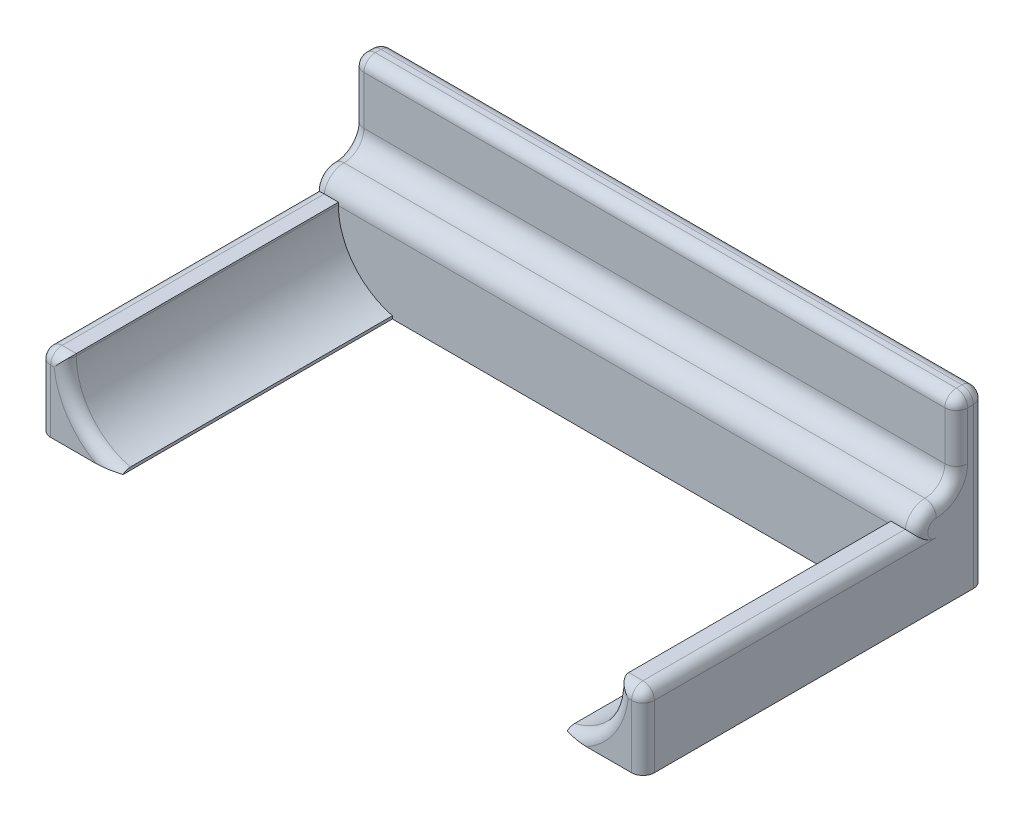
from build123d import *

# Parameters (mm, degrees)
ESQUISSE1_W             = 53
ESQUISSE1_H             = 20
BOSS_EXTRU_1_DEPTH      = 30
ESQUISSE2_W             = 53
ESQUISSE2_H             = 27.5
ENL_V_MAT_EXTRU_1_DEPTH = 17.5
ESQUISSE8_W             = 53
ESQUISSE8_H             = 5
ENL_V_MAT_EXTRU_5_DEPTH = 65.101482042
ESQUISSE10_W            = 39
ESQUISSE10_H            = 24
ENL_V_MAT_EXTRU_6_DEPTH = 3
ESQUISSE11_W            = 53
ESQUISSE11_H            = 3.5
BOSS_EXTRU_3_DEPTH      = 5.5
ESQUISSE12_W            = 4.75
ESQUISSE12_H            = 24
ENL_V_MAT_EXTRU_7_DEPTH = 2.25
ESQUISSE13_W            = 2.25
ESQUISSE13_H            = 24
BOSS_EXTRU_4_DEPTH      = 4
CONG_14_R               = 1.75
CONG_16_R               = 6.25
CONG_17_R               = 1


# Some blends are built 0.0001 mm under size
with BuildPart() as part:
    # Esquisse1 → Boss.-Extru.1 (new body)
    with BuildSketch(Plane.XY):
        with Locations((26.5, 10)):
            Rectangle(ESQUISSE1_W, ESQUISSE1_H)
    extrude(amount=BOSS_EXTRU_1_DEPTH)

    # Esquisse2 → Enlèv. mat.-Extru.1 (cut)
    with BuildSketch(Plane(origin=(0, 20, 0), x_dir=(1, 0, 0), z_dir=(0, 1, 0))):
        with Locations((26.5, -16.25)):
            Rectangle(ESQUISSE2_W, ESQUISSE2_H)
    extrude(amount=-ENL_V_MAT_EXTRU_1_DEPTH, mode=Mode.SUBTRACT)

    # Esquisse8 → Enlèv. mat.-Extru.5 (cut, through all)
    with BuildSketch(Plane(origin=(0, 0, 0), x_dir=(-1, 0, 0), z_dir=(0, 0, -1))):
        with Locations((-26.5, 17.5)):
            Rectangle(ESQUISSE8_W, ESQUISSE8_H)
    extrude(amount=-ENL_V_MAT_EXTRU_5_DEPTH, mode=Mode.SUBTRACT)

    # Esquisse10 → Enlèv. mat.-Extru.6 (cut)
    with BuildSketch(Plane(origin=(0, 2.5, 0), x_dir=(1, 0, 0), z_dir=(0, 1, 0))):
        with Locations((26.5, -18)):
            Rectangle(ESQUISSE10_W, ESQUISSE10_H)
    extrude(amount=-ENL_V_MAT_EXTRU_6_DEPTH, mode=Mode.SUBTRACT)

    # Esquisse11 → Boss.-Extru.3 (add)
    with BuildSketch(Plane(origin=(0, 2.5, 0), x_dir=(1, 0, 0), z_dir=(0, 1, 0))):
        with Locations((26.5, -4.25)):
            Rectangle(ESQUISSE11_W, ESQUISSE11_H)
    extrude(amount=BOSS_EXTRU_3_DEPTH)

    # Esquisse12 → Enlèv. mat.-Extru.7 (cut)
    with BuildSketch(Plane(origin=(0, 2.5, 0), x_dir=(1, 0, 0), z_dir=(0, 1, 0))):
        with Locations((4.625, -18)):
            Rectangle(ESQUISSE12_W, ESQUISSE12_H)
        with Locations((48.375, -18)):
            Rectangle(ESQUISSE12_W, ESQUISSE12_H)
    extrude(amount=-ENL_V_MAT_EXTRU_7_DEPTH, mode=Mode.SUBTRACT)

    # Esquisse13 → Boss.-Extru.4 (add)
    with BuildSketch(Plane(origin=(0, 2.5, 0), x_dir=(1, 0, 0), z_dir=(0, 1, 0))):
        with Locations((1.125, -18)):
            Rectangle(ESQUISSE13_W, ESQUISSE13_H)
        with Locations((51.875, -18)):
            Rectangle(ESQUISSE13_W, ESQUISSE13_H)
    extrude(amount=BOSS_EXTRU_4_DEPTH)

    # Congé14
    cong_14_edges = [part.edges().sort_by_distance(p)[0] for p in [
        (26.5, 8, 6),
        (26.5, 8, 2.5),
    ]]
    fillet(cong_14_edges, radius=CONG_14_R - 0.0001)  # a hair under: the kernel refuses the full size

    # Congé16
    # the kernel refuses this fillet: 6.25 mm, written as the material it adds along each edge
    with BuildSketch(Plane(origin=(2.25, 0.25, 30), x_dir=(0, 1, 0), z_dir=(0, 0, -1)), Plane(origin=(50.75, 0.25, 6), x_dir=(0, 1, 0), z_dir=(0, 0, 1))) as cong_16_piece_1:
        with BuildLine():
            CenterArc((6.06733055, 6.25), CONG_16_R, 193.886540363, 76.113459637)
            Line((0, 4.75), (-0.121346611, 4.72))
            ThreePointArc((-0.121346611, 4.72), (-0.125, 2.375), (-0.125, 0))
            Line((-0.125, 0), (0, -0.125))
            Line((0, -0.125), (6.06733055, -0.125))
            Line((6.06733055, -0.125), (6.06733055, 0))
        make_face()
    extrude(amount=24)

    # Congé17
    # the kernel refuses this fillet: 1 mm, written as the material it takes off along each edge
    with BuildSketch(Plane(origin=(52, 14, 1.5), x_dir=(1, 0, 0), z_dir=(0, 1, 0))) as cong_17_piece_1_section:
        Polygon((0, 0), (CONG_17_R, 0), (CONG_17_R, -CONG_17_R), (0, -CONG_17_R), align=None)
    cong_17_piece_1 = extrude(amount=CONG_17_R, mode=Mode.PRIVATE)
    cong_17_piece_1 = cong_17_piece_1 - Plane(origin=(52, 14, 1.5), x_dir=(-0.7071067811865475, 0, -0.7071067811865475), z_dir=(0, 1, 0)) * Sphere(CONG_17_R, mode=Mode.PRIVATE)
    add(cong_17_piece_1, mode=Mode.SUBTRACT)
    with BuildSketch(Plane(origin=(1, 14, 1.5), x_dir=(0, 0, 1), z_dir=(0, 1, 0))) as cong_17_piece_2_section:
        Polygon((0, 0), (CONG_17_R, 0), (CONG_17_R, -CONG_17_R), (0, -CONG_17_R), align=None)
    cong_17_piece_2 = extrude(amount=CONG_17_R, mode=Mode.PRIVATE)
    cong_17_piece_2 = cong_17_piece_2 - Plane(origin=(1, 14, 1.5), x_dir=(0.7071067811865475, 0, -0.7071067811865475), z_dir=(0, 1, 0)) * Sphere(CONG_17_R, mode=Mode.PRIVATE)
    add(cong_17_piece_2, mode=Mode.SUBTRACT)
    with BuildSketch(Plane(origin=(52, 14, 1), x_dir=(0, 1, 0), z_dir=(0, 0, -1))) as cong_17_piece_3_section:
        Polygon((0, 0), (CONG_17_R, 0), (CONG_17_R, CONG_17_R), (0, CONG_17_R), align=None)
    cong_17_piece_3 = extrude(amount=CONG_17_R, mode=Mode.PRIVATE)
    cong_17_piece_3 = cong_17_piece_3 - Plane(origin=(52, 14, 1), x_dir=(-0.7071067811865475, -0.7071067811865475, 0), z_dir=(0, 0, -1)) * Sphere(CONG_17_R, mode=Mode.PRIVATE)
    add(cong_17_piece_3, mode=Mode.SUBTRACT)
    with BuildSketch(Plane(origin=(1, 14, 1), x_dir=(0, 1, 0), z_dir=(0, 0, -1))) as cong_17_piece_4_section:
        Polygon((0, 0), (CONG_17_R, 0), (CONG_17_R, -CONG_17_R), (0, -CONG_17_R), align=None)
    cong_17_piece_4 = extrude(amount=CONG_17_R, mode=Mode.PRIVATE)
    cong_17_piece_4 = cong_17_piece_4 - Plane(origin=(1, 14, 1), x_dir=(0.7071067811865475, -0.7071067811865475, 0), z_dir=(0, 0, -1)) * Sphere(CONG_17_R, mode=Mode.PRIVATE)
    add(cong_17_piece_4, mode=Mode.SUBTRACT)
    with BuildSketch(Plane(origin=(1, 5.5, 29), x_dir=(-1, 0, 0), z_dir=(0, 0, 1))) as cong_17_piece_5_section:
        Polygon((0, 0), (CONG_17_R, 0), (CONG_17_R, -CONG_17_R), (0, -CONG_17_R), align=None)
    cong_17_piece_5 = extrude(amount=CONG_17_R, mode=Mode.PRIVATE)
    cong_17_piece_5 = cong_17_piece_5 - Plane(origin=(1, 5.5, 29), x_dir=(0.7071067811865475, -0.7071067811865475, 0), z_dir=(0, 0, 1)) * Sphere(CONG_17_R, mode=Mode.PRIVATE)
    add(cong_17_piece_5, mode=Mode.SUBTRACT)
    with BuildSketch(Plane(origin=(52, 5.5, 29), x_dir=(1, 0, 0), z_dir=(0, 1, 0))) as cong_17_piece_6_section:
        Polygon((0, 0), (CONG_17_R, 0), (CONG_17_R, -CONG_17_R), (0, -CONG_17_R), align=None)
    cong_17_piece_6 = extrude(amount=CONG_17_R, mode=Mode.PRIVATE)
    cong_17_piece_6 = cong_17_piece_6 - Plane(origin=(52, 5.5, 29), x_dir=(-0.7071067811865475, 0, -0.7071067811865475), z_dir=(0, 1, 0)) * Sphere(CONG_17_R, mode=Mode.PRIVATE)
    add(cong_17_piece_6, mode=Mode.SUBTRACT)
    with BuildSketch(Plane(origin=(0, 6.2501, 4.2501), x_dir=(0, 1, 0), z_dir=(0, 0, -1))) as cong_17_piece_7_section:
        with BuildLine():
            CenterArc((1.7499 - CONG_17_R, CONG_17_R), CONG_17_R, 270, 90)
            Line((1.7499 - CONG_17_R, 0), (1.7499, 0))
            Line((1.7499, 0), (1.7499, CONG_17_R))
        make_face()
    cong_17_piece_7 = revolve(axis=Axis((0, 6.2501, 4.2501), (1, 0, 0)), revolution_arc=163.672570945, mode=Mode.PRIVATE)
    cong_17_piece_7 = split(cong_17_piece_7, bisect_by=Plane(origin=(0.246556044, 6.5, 5.177662637), z_dir=(0, 1, 0)), keep=Keep.TOP, mode=Mode.PRIVATE)
    add(cong_17_piece_7, mode=Mode.SUBTRACT)
    with BuildSketch(Plane(origin=(0, 9.7499, 4.2499), x_dir=(0, -1, 0), z_dir=(0, 0, 1))) as cong_17_piece_8:
        with BuildLine():
            CenterArc((1.7499 + CONG_17_R, CONG_17_R), CONG_17_R, 180, 90)
            Line((1.7499, CONG_17_R), (1.7499, 0))
            Line((1.7499, 0), (1.7499 + CONG_17_R, 0))
        make_face()
    revolve(axis=Axis((0, 9.7499, 4.2499), (1, 0, 0)), revolution_arc=90, mode=Mode.SUBTRACT)
    with BuildSketch(Plane(origin=(53, 14, 2.5), x_dir=(0, 0, -1), z_dir=(0, -1, 0))) as cong_17_piece_9:
        with BuildLine():
            CenterArc((CONG_17_R, -CONG_17_R), CONG_17_R, 90, 90)
            Line((0, -CONG_17_R), (0, 0))
            Line((0, 0), (CONG_17_R, 0))
        make_face()
    extrude(amount=4.2501, mode=Mode.SUBTRACT)
    with BuildSketch(Plane(origin=(53, 9.7499, 4.2499), x_dir=(0, -1, 0), z_dir=(0, 0, 1))) as cong_17_piece_10:
        with BuildLine():
            CenterArc((1.7499 + CONG_17_R, -CONG_17_R), CONG_17_R, 90, 90)
            Line((1.7499, -CONG_17_R), (1.7499, 0))
            Line((1.7499, 0), (1.7499 + CONG_17_R, 0))
        make_face()
    revolve(axis=Axis((53, 9.7499, 4.2499), (1, 0, 0)), revolution_arc=90, mode=Mode.SUBTRACT)
    with BuildSketch(Plane(origin=(0, 14, 2.5), x_dir=(0, 0, -1), z_dir=(0, -1, 0))) as cong_17_piece_11:
        with BuildLine():
            CenterArc((CONG_17_R, CONG_17_R), CONG_17_R, 180, 90)
            Line((0, CONG_17_R), (0, 0))
            Line((0, 0), (CONG_17_R, 0))
        make_face()
    extrude(amount=4.2501, mode=Mode.SUBTRACT)
    with BuildSketch(Plane(origin=(53, 15, 1), x_dir=(0, -1, 0), z_dir=(0, 0, 1))) as cong_17_piece_12:
        with BuildLine():
            CenterArc((CONG_17_R, -CONG_17_R), CONG_17_R, 90, 90)
            Line((0, -CONG_17_R), (0, 0))
            Line((0, 0), (CONG_17_R, 0))
        make_face()
    extrude(amount=0.5, mode=Mode.SUBTRACT)
    with BuildSketch(Plane(origin=(0, 15, 1), x_dir=(0, -1, 0), z_dir=(0, 0, 1))) as cong_17_piece_13:
        with BuildLine():
            CenterArc((CONG_17_R, CONG_17_R), CONG_17_R, 180, 90)
            Line((0, CONG_17_R), (0, 0))
            Line((0, 0), (CONG_17_R, 0))
        make_face()
    extrude(amount=0.5, mode=Mode.SUBTRACT)
    with BuildSketch(Plane(origin=(0, 14, 0), x_dir=(1, 0, 0), z_dir=(0, -1, 0)), Plane(origin=(53, -2.5, 0), x_dir=(-1, 0, 0), z_dir=(0, 1, 0))) as cong_17_piece_14:
        with BuildLine():
            CenterArc((CONG_17_R, CONG_17_R), CONG_17_R, 180, 90)
            Line((0, CONG_17_R), (0, 0))
            Line((0, 0), (CONG_17_R, 0))
        make_face()
    extrude(amount=16.5, mode=Mode.SUBTRACT)
    with BuildSketch(Plane(origin=(1, 15, 0), x_dir=(0, -1, 0), z_dir=(1, 0, 0))) as cong_17_piece_15:
        with BuildLine():
            CenterArc((CONG_17_R, -CONG_17_R), CONG_17_R, 90, 90)
            Line((0, -CONG_17_R), (0, 0))
            Line((0, 0), (CONG_17_R, 0))
        make_face()
    extrude(amount=51, mode=Mode.SUBTRACT)
    with BuildSketch(Plane(origin=(52, 15, 2.5), x_dir=(0, 0, -1), z_dir=(-1, 0, 0))) as cong_17_piece_16:
        with BuildLine():
            CenterArc((CONG_17_R, CONG_17_R), CONG_17_R, 180, 90)
            Line((0, CONG_17_R), (0, 0))
            Line((0, 0), (CONG_17_R, 0))
        make_face()
    extrude(amount=51, mode=Mode.SUBTRACT)
    with BuildSketch(Plane(origin=(53, 6.2501, 4.2501), x_dir=(0, 1, 0), z_dir=(0, 0, -1))) as cong_17_piece_17_section:
        with BuildLine():
            CenterArc((1.7499 - CONG_17_R, -CONG_17_R), CONG_17_R, 0, 90)
            Line((1.7499 - CONG_17_R, 0), (1.7499, 0))
            Line((1.7499, 0), (1.7499, -CONG_17_R))
        make_face()
    cong_17_piece_17 = revolve(axis=Axis((53, 6.2501, 4.2501), (1, 0, 0)), revolution_arc=163.672570945, mode=Mode.PRIVATE)
    cong_17_piece_17 = split(cong_17_piece_17, bisect_by=Plane(origin=(52.753443954, 6.5, 5.17766264), z_dir=(0, 1, 0)), keep=Keep.TOP, mode=Mode.PRIVATE)
    add(cong_17_piece_17, mode=Mode.SUBTRACT)
    with BuildSketch(Plane(origin=(0, 6.5, 29), x_dir=(1, 0, 0), z_dir=(0, 0, -1))) as cong_17_piece_18_section:
        with BuildLine():
            CenterArc((CONG_17_R, CONG_17_R), CONG_17_R, 180, 90)
            Line((0, CONG_17_R), (0, 0))
            Line((0, 0), (CONG_17_R, 0))
        make_face()
    cong_17_piece_18 = extrude(amount=25.517935797, mode=Mode.PRIVATE)
    cong_17_piece_18 = cong_17_piece_18 - Plane(origin=(0.226363525, 6.2501, 4.2501), x_dir=(0, 1, 0), z_dir=(-1, 0, 0)) * Cylinder(1.7499, 56, mode=Mode.PRIVATE)
    add(cong_17_piece_18, mode=Mode.SUBTRACT)
    with BuildSketch(Plane(origin=(53, 6.5, 3.482064203), x_dir=(0, -1, 0), z_dir=(0, 0, 1))) as cong_17_piece_19_section:
        with BuildLine():
            CenterArc((CONG_17_R, -CONG_17_R), CONG_17_R, 90, 90)
            Line((0, -CONG_17_R), (0, 0))
            Line((0, 0), (CONG_17_R, 0))
        make_face()
    cong_17_piece_19 = extrude(amount=25.517935797, mode=Mode.PRIVATE)
    cong_17_piece_19 = cong_17_piece_19 - Plane(origin=(52.773636475, 6.2501, 4.2501), x_dir=(0, 1, 0), z_dir=(-1, 0, 0)) * Cylinder(1.7499, 56, mode=Mode.PRIVATE)
    add(cong_17_piece_19, mode=Mode.SUBTRACT)
    with BuildSketch(Plane(origin=(53, 5.5, 30), x_dir=(0, 0, -1), z_dir=(0, -1, 0)), Plane(origin=(0, 5.5, 30), x_dir=(1, 0, 0), z_dir=(0, -1, 0))) as cong_17_piece_20:
        with BuildLine():
            CenterArc((CONG_17_R, -CONG_17_R), CONG_17_R, 90, 90)
            Line((0, -CONG_17_R), (0, 0))
            Line((0, 0), (CONG_17_R, 0))
        make_face()
    extrude(amount=8, mode=Mode.SUBTRACT)
    with BuildSketch(Plane(origin=(44.5, 6.31733055, 30), x_dir=(-0.15709561863932892, -0.9875833972907435, 0), z_dir=(-0.9875833972907435, 0.15709561863932892, 0))) as cong_17_piece_21:
        with BuildLine():
            CenterArc((6.25 + CONG_17_R, -CONG_17_R), CONG_17_R, 90, 90)
            Line((6.25 + CONG_17_R, 0), (6.25, 0))
            Line((6.25, 0), (6.25, -CONG_17_R))
        make_face()
    revolve(axis=Axis((44.5, 6.31733055, 30), (0, 0, 1)), revolution_arc=99.038355542, mode=Mode.SUBTRACT)
    with BuildSketch(Plane(origin=(52, 6.5, 30), x_dir=(0, -1, 0), z_dir=(-1, 0, 0)), Plane(origin=(4.75, 6.5, 30), x_dir=(0, -1, 0), z_dir=(-1, 0, 0))) as cong_17_piece_22:
        with BuildLine():
            CenterArc((CONG_17_R, -CONG_17_R), CONG_17_R, 90, 90)
            Line((0, -CONG_17_R), (0, 0))
            Line((0, 0), (CONG_17_R, 0))
        make_face()
    extrude(amount=3.75, mode=Mode.SUBTRACT)
    with BuildSketch(Plane(origin=(8.5, 6.31733055, 30), x_dir=(0.15709561863932892, -0.9875833972907435, 0), z_dir=(0.9875833972907435, 0.15709561863932892, 0))) as cong_17_piece_23:
        with BuildLine():
            CenterArc((6.25 + CONG_17_R, CONG_17_R), CONG_17_R, 180, 90)
            Line((6.25 + CONG_17_R, 0), (6.25, 0))
            Line((6.25, 0), (6.25, CONG_17_R))
        make_face()
    revolve(axis=Axis((8.5, 6.31733055, 30), (0, 0, -1)), revolution_arc=99.038355542, mode=Mode.SUBTRACT)
    with BuildSketch(Plane(origin=(2.25, 6.31733055, 30), x_dir=(0, 0, -1), z_dir=(0, 1, 0))) as cong_17_piece_24:
        with BuildLine():
            CenterArc((CONG_17_R, CONG_17_R), CONG_17_R, 180, 90)
            Line((0, CONG_17_R), (0, 0))
            Line((0, 0), (CONG_17_R, 0))
        make_face()
    extrude(amount=2.68266945, mode=Mode.SUBTRACT)
    with BuildSketch(Plane(origin=(50.75, 9, 30), x_dir=(1, 0, 0), z_dir=(0, -1, 0))) as cong_17_piece_25:
        with BuildLine():
            CenterArc((CONG_17_R, -CONG_17_R), CONG_17_R, 90, 90)
            Line((0, -CONG_17_R), (0, 0))
            Line((0, 0), (CONG_17_R, 0))
        make_face()
    extrude(amount=2.68266945, mode=Mode.SUBTRACT)
    with BuildSketch(Plane(origin=(53, 8, 4.2499), x_dir=(0, -1, 0), z_dir=(0, 0, 1)), Plane(origin=(0, 8, 4.2501), x_dir=(0, -1, 0), z_dir=(0, 0, -1))) as cong_17_piece_26:
        with BuildLine():
            CenterArc((CONG_17_R, -CONG_17_R), CONG_17_R, 90, 90)
            Line((0, -CONG_17_R), (0, 0))
            Line((0, 0), (CONG_17_R, 0))
        make_face()
    extrude(amount=0.0002, mode=Mode.SUBTRACT)
    with BuildSketch(Plane(origin=(0, 6.5, 29), x_dir=(1, 0, 0), z_dir=(0, 0, -1))) as cong_17_piece_27a_section:
        with BuildLine():
            CenterArc((CONG_17_R, CONG_17_R), CONG_17_R, 180, 90)
            Line((0, CONG_17_R), (0, 0))
            Line((0, 0), (CONG_17_R, 0))
        make_face()
    cong_17_piece_27a = extrude(amount=25.517935797, mode=Mode.PRIVATE)
    cong_17_piece_27a = cong_17_piece_27a & Plane(origin=(0.226685784, 6.2501, 4.2501), x_dir=(0, 1, 0), z_dir=(-1, 0, 0)) * Cylinder(1.7499, 56, mode=Mode.PRIVATE)
    with BuildSketch(Plane(origin=(0, 6.2501, 4.2501), x_dir=(0, 1, 0), z_dir=(0, 0, -1))) as cong_17_piece_27b_section:
        with BuildLine():
            CenterArc((1.7499 - CONG_17_R, CONG_17_R), CONG_17_R, 270, 90)
            Line((1.7499 - CONG_17_R, 0), (1.7499, 0))
            Line((1.7499, 0), (1.7499, CONG_17_R))
        make_face()
    cong_17_piece_27b = revolve(axis=Axis((0, 6.2501, 4.2501), (1, 0, 0)), revolution_arc=163.672570945, mode=Mode.PRIVATE)
    cong_17_piece_27b = split(cong_17_piece_27b, bisect_by=Plane(origin=(0.242344233, 6.5, 5.450399752), z_dir=(0, -1, 0)), keep=Keep.TOP, mode=Mode.PRIVATE)
    cong_17_piece_27 = cong_17_piece_27a & cong_17_piece_27b
    add(cong_17_piece_27, mode=Mode.SUBTRACT)
    with BuildSketch(Plane(origin=(53, 6.2501, 4.2501), x_dir=(0, 1, 0), z_dir=(0, 0, -1))) as cong_17_piece_28a_section:
        with BuildLine():
            CenterArc((1.7499 - CONG_17_R, -CONG_17_R), CONG_17_R, 0, 90)
            Line((1.7499 - CONG_17_R, 0), (1.7499, 0))
            Line((1.7499, 0), (1.7499, -CONG_17_R))
        make_face()
    cong_17_piece_28a = revolve(axis=Axis((53, 6.2501, 4.2501), (1, 0, 0)), revolution_arc=163.672570945, mode=Mode.PRIVATE)
    cong_17_piece_28a = split(cong_17_piece_28a, bisect_by=Plane(origin=(52.757655764, 6.5, 5.450399753), z_dir=(0, -1, 0)), keep=Keep.TOP, mode=Mode.PRIVATE)
    with BuildSketch(Plane(origin=(53, 6.5, 3.482064203), x_dir=(0, -1, 0), z_dir=(0, 0, 1))) as cong_17_piece_28b_section:
        with BuildLine():
            CenterArc((CONG_17_R, -CONG_17_R), CONG_17_R, 90, 90)
            Line((0, -CONG_17_R), (0, 0))
            Line((0, 0), (CONG_17_R, 0))
        make_face()
    cong_17_piece_28b = extrude(amount=25.517935797, mode=Mode.PRIVATE)
    cong_17_piece_28b = cong_17_piece_28b & Plane(origin=(52.773314223, 6.2501, 4.2501), x_dir=(0, 1, 0), z_dir=(-1, 0, 0)) * Cylinder(1.7499, 56, mode=Mode.PRIVATE)
    cong_17_piece_28 = cong_17_piece_28a & cong_17_piece_28b
    add(cong_17_piece_28, mode=Mode.SUBTRACT)


solid = part.part
